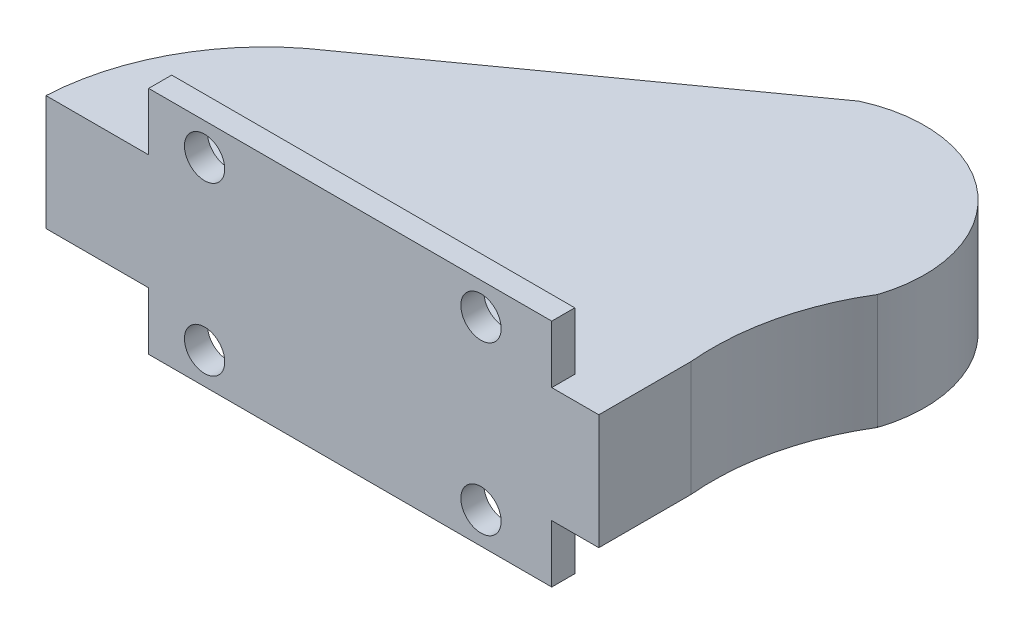
from build123d import *

# Parameters (mm, degrees)
BOSS_EXTRUDE1_DEPTH = 10
SKETCH2_W           = 35
SKETCH2_H           = 5
BOSS_EXTRUDE2_DEPTH = 2
SKETCH3_R           = 1.75
CUT_EXTRUDE1_DEPTH  = 2


with BuildPart() as part:
    # Sketch1 → Boss-Extrude1 (new body)
    with BuildSketch(Plane(origin=(0, 0, 0), x_dir=(1, 0, 0), z_dir=(0, 1, 0))):
        with BuildLine():
            Line((0, 0), (48, 0))
            Line((48, 0), (48, 8))
            ThreePointArc((48, 8), (48.467060864, 14.822123853), (51.057462003, 21.150578771))
            ThreePointArc((51.057462003, 21.150578771), (47.881337815, 33.032979771), (35.722119028, 34.885712045))
            Line((35.722119028, 34.885712045), (8.895994561, 15.666996008))
            ThreePointArc((8.895994561, 15.666996008), (2.585676696, 8.890956229), (0, 0))
        make_face()
    extrude(amount=BOSS_EXTRUDE1_DEPTH)

    # Sketch2 → Boss-Extrude2 (add)
    with BuildSketch(Plane.XY):
        with Locations((26.413010925, -2.5)):
            Rectangle(SKETCH2_W, SKETCH2_H)
        with Locations((26.413010925, 12.5)):
            Rectangle(SKETCH2_W, SKETCH2_H)
    extrude(amount=-BOSS_EXTRUDE2_DEPTH)

    # Sketch3 → Cut-Extrude1 (cut)
    with BuildSketch(Plane(origin=(0, 0, -2), x_dir=(-1, 0, 0), z_dir=(0, 0, -1))):
        with Locations((-13.769448398, -2.263474859)):
            Circle(SKETCH3_R)
        with Locations((-37.769448398, -2.263474859)):
            Circle(SKETCH3_R)
        with Locations((-37.769448398, 12.236525141)):
            Circle(SKETCH3_R)
        with Locations((-13.769448398, 12.236525141)):
            Circle(SKETCH3_R)
    extrude(amount=-CUT_EXTRUDE1_DEPTH, mode=Mode.SUBTRACT)


solid = part.part
